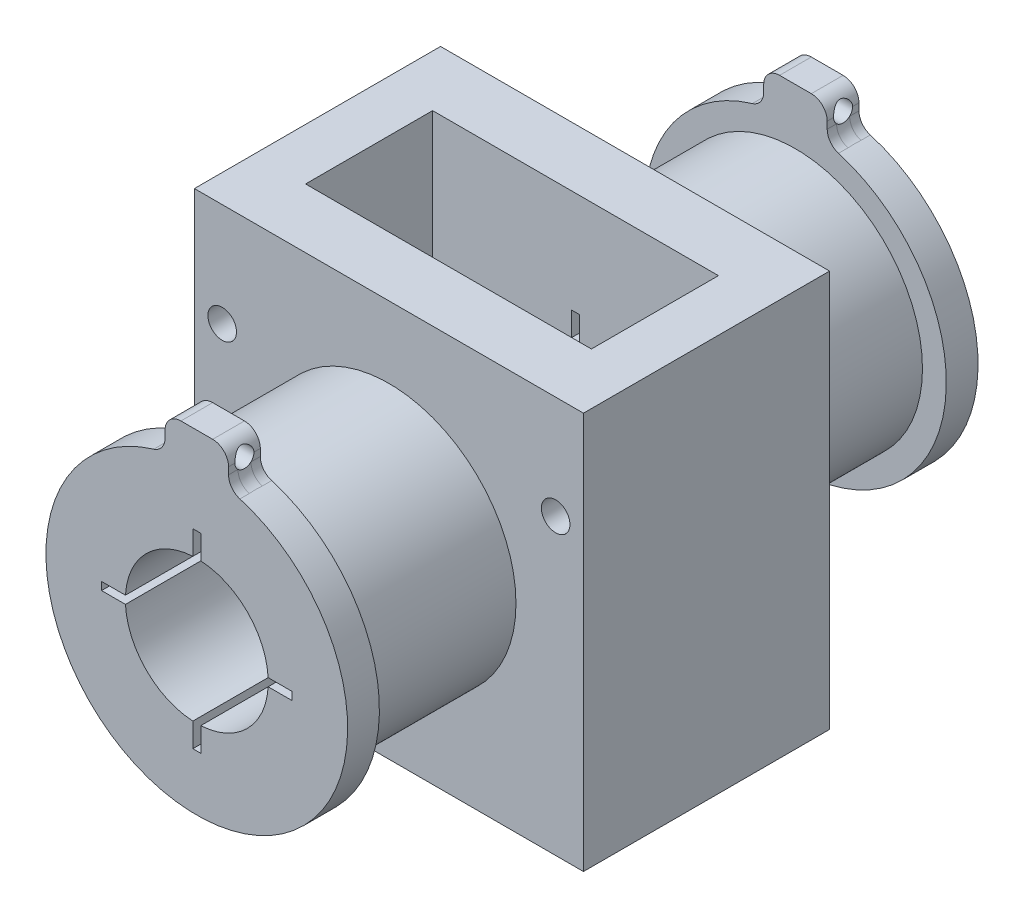
from build123d import *

# Parameters (mm, degrees)
SKETCH1_W           = 24.5
SKETCH1_H           = 25
BOSS_EXTRUDE1_DEPTH = 7.75
SKETCH2_R           = 8
BOSS_EXTRUDE2_DEPTH = 12.1
SKETCH3_R           = 4.5
CUT_EXTRUDE1_DEPTH  = 65
SKETCH4_W           = 18
SKETCH4_H           = 8
CUT_EXTRUDE2_DEPTH  = 26
SKETCH16_R          = 9.5
SKETCH16_R_2        = 4.5
BOSS_EXTRUDE6_DEPTH = 2
SKETCH7_W           = 12
SKETCH7_H           = 0.5
CUT_EXTRUDE3_DEPTH  = 46.25
CIRPATTERN1_COUNT   = 2
CIRPATTERN1_ANGLE   = 90
SKETCH17_R          = 0.9
CUT_EXTRUDE5_DEPTH  = 52
SKETCH18_W          = 2
SKETCH18_H          = 3.5
SKETCH18_R          = 0.6
BOSS_EXTRUDE7_DEPTH = 2
FILLET1_R           = 1


with BuildPart() as part:
    # Sketch1 → Boss-Extrude1 (new, symmetric)
    with BuildSketch(Plane.XY):
        Rectangle(SKETCH1_W, SKETCH1_H)
    extrude(amount=BOSS_EXTRUDE1_DEPTH, both=True)

    # Sketch2 → Boss-Extrude2 (add)
    with BuildSketch(Plane.XY.offset(7.75)):
        Circle(SKETCH2_R)
    boss_extrude2 = extrude(amount=BOSS_EXTRUDE2_DEPTH)

    # Mirror1: Boss-Extrude2 across plane
    add(boss_extrude2.mirror(Plane.XY))

    # Sketch3 → Cut-Extrude1 (cut)
    with BuildSketch(Plane.XY.offset(19.85)):
        Circle(SKETCH3_R)
    extrude(amount=-CUT_EXTRUDE1_DEPTH, mode=Mode.SUBTRACT)

    # Sketch4 → Cut-Extrude2 (cut)
    with BuildSketch(Plane(origin=(0, 12.5, 0), x_dir=(1, 0, 0), z_dir=(0, 1, 0))):
        Rectangle(SKETCH4_W, SKETCH4_H)
    extrude(amount=-CUT_EXTRUDE2_DEPTH, mode=Mode.SUBTRACT)

    # Sketch16 → Boss-Extrude6 (add)
    with BuildSketch(Plane.XY.offset(19.85)):
        Circle(SKETCH16_R)
        with Locations(Location((0, 0, 0), (0, 0, 180))):
            Circle(SKETCH16_R_2, mode=Mode.SUBTRACT)
    boss_extrude6 = extrude(amount=-BOSS_EXTRUDE6_DEPTH)

    # Mirror3: Boss-Extrude6 across plane
    add(boss_extrude6.mirror(Plane.XY))

    # Sketch7 → Cut-Extrude3 (cut, symmetric)
    with BuildSketch(Plane.XY):
        Rectangle(SKETCH7_W, SKETCH7_H)
    cut_extrude3 = extrude(amount=CUT_EXTRUDE3_DEPTH, both=True, mode=Mode.SUBTRACT)

    # CirPattern1: Cut-Extrude3 ×2 about axis
    cirpattern1_axis = Axis((0, 0, 0), (0, 0, 1))
    for i in range(1, CIRPATTERN1_COUNT):
        add(cut_extrude3.rotate(cirpattern1_axis, i * CIRPATTERN1_ANGLE / (CIRPATTERN1_COUNT - 1)), mode=Mode.SUBTRACT)

    # Sketch17 → Cut-Extrude5 (cut)
    with BuildSketch(Plane.XY.offset(19.85)):
        with Locations((-10.5, 6)):
            Circle(SKETCH17_R)
    cut_extrude5 = extrude(amount=-CUT_EXTRUDE5_DEPTH, mode=Mode.SUBTRACT)

    # Mirror2: Cut-Extrude5 across plane
    add(cut_extrude5.mirror(Plane(origin=(0, 0, 0), x_dir=(0, 0, 1), z_dir=(1, 0, 0))), mode=Mode.SUBTRACT)

    # Sketch18 → Boss-Extrude7 (add, symmetric)
    with BuildSketch(Plane(origin=(0, 0, 0), x_dir=(0, 0, -1), z_dir=(1, 0, 0))):
        with Locations((-18.85, 9.75)):
            Rectangle(SKETCH18_W, SKETCH18_H)
        with Locations((-18.85, 10.5)):
            Circle(SKETCH18_R, mode=Mode.SUBTRACT)
    boss_extrude7 = extrude(amount=BOSS_EXTRUDE7_DEPTH, both=True)

    # Mirror4: Boss-Extrude7 across plane
    add(boss_extrude7.mirror(Plane.XY))

    # Fillet1
    fillet1_edges = [part.edges().sort_by_distance(p)[0] for p in [
        (-2, 9.287087811, 18.85),
        (2, 9.287087811, 18.85),
        (-2, 9.287087811, -18.85),
        (2, 9.287087811, -18.85),
    ]]
    fillet(fillet1_edges, radius=FILLET1_R)
    # the kernel refuses this fillet: 1 mm, written as the material it takes off along each edge
    with BuildSketch(Plane(origin=(2, 11.5, 22.35), x_dir=(0, -1, 0), z_dir=(0, 0, -1)), Plane(origin=(-2, 11.5, -22.35), x_dir=(0, -1, 0), z_dir=(0, 0, 1))) as fillet1_2_piece_1:
        with BuildLine():
            CenterArc((FILLET1_R, FILLET1_R), FILLET1_R, 180, 90)
            Line((0, FILLET1_R), (-FILLET1_R * 0.02, FILLET1_R))
            Line((-FILLET1_R * 0.02, FILLET1_R), (-FILLET1_R * 0.02, -FILLET1_R * 0.02))
            Line((-FILLET1_R * 0.02, -FILLET1_R * 0.02), (FILLET1_R, -FILLET1_R * 0.02))
            Line((FILLET1_R, -FILLET1_R * 0.02), (FILLET1_R, 0))
        make_face()
    extrude(amount=7, mode=Mode.SUBTRACT)
    with BuildSketch(Plane(origin=(-2, 11.5, 22.35), x_dir=(0, -1, 0), z_dir=(0, 0, -1)), Plane(origin=(2, 11.5, -22.35), x_dir=(0, -1, 0), z_dir=(0, 0, 1))) as fillet1_2_piece_2:
        with BuildLine():
            CenterArc((FILLET1_R, -FILLET1_R), FILLET1_R, 90, 90)
            Line((0, -FILLET1_R), (-FILLET1_R * 0.02, -FILLET1_R))
            Line((-FILLET1_R * 0.02, -FILLET1_R), (-FILLET1_R * 0.02, FILLET1_R * 0.02))
            Line((-FILLET1_R * 0.02, FILLET1_R * 0.02), (FILLET1_R, FILLET1_R * 0.02))
            Line((FILLET1_R, FILLET1_R * 0.02), (FILLET1_R, 0))
        make_face()
    extrude(amount=7, mode=Mode.SUBTRACT)


solid = part.part
